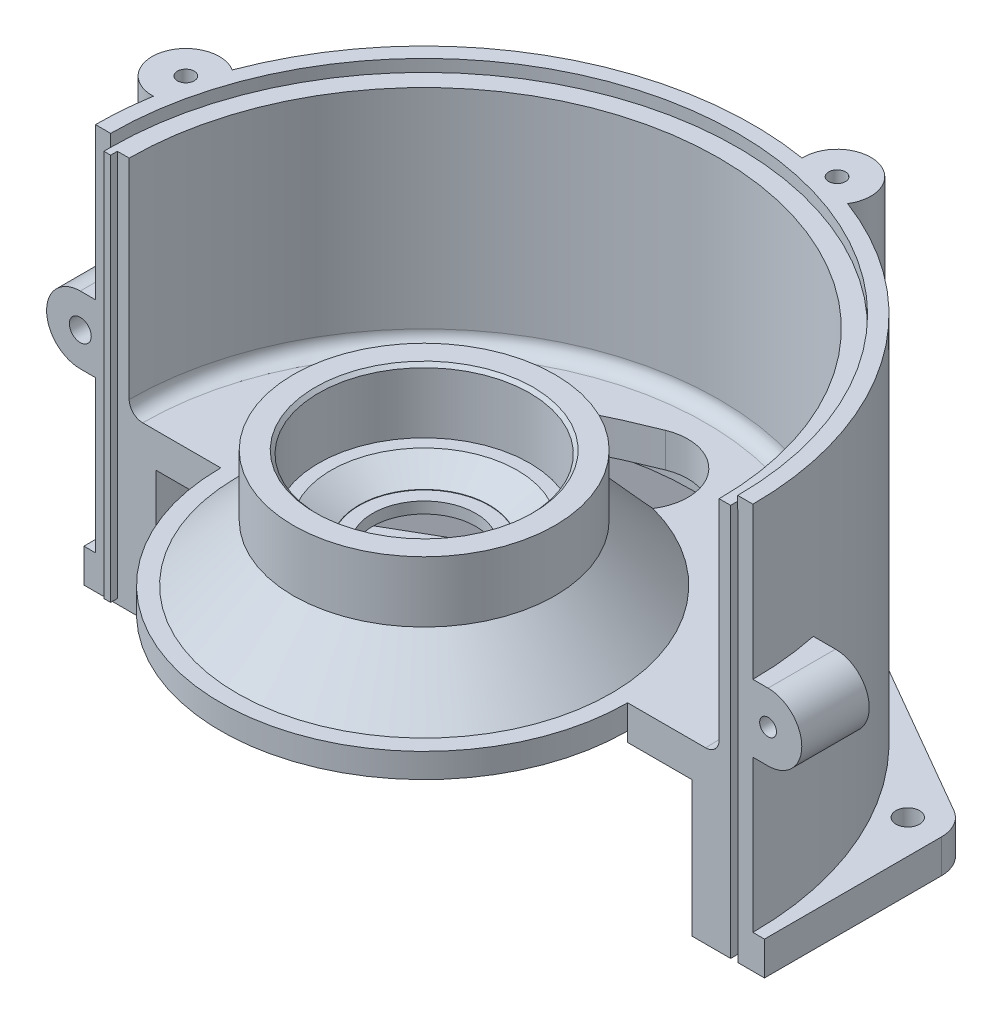
from build123d import *
from build123d.topology import SkipClean

# Parameters (mm, degrees)
REVOLU_O2_ANGLE           = 180
ESBO_O4_R                 = 10
RESSALTO_EXTRUS_O1_DEPTH  = 35
RESSALTO_EXTRUS_O10_DEPTH = 10
ESBO_O8_R                 = 3.5
CORTE_EXTRUS_O2_DEPTH     = 20
PADR_OCIRCULAR1_COUNT     = 6
ESBO_O6_R                 = 2.5
CORTE_EXTRUS_O1_DEPTH     = 15
ESBO_O9_R                 = 1.25
CORTE_EXTRUS_O3_DEPTH     = 6
ESBO_O10_W                = 2.2
ESBO_O10_H                = 116.4
CORTE_EXTRUS_O4_DEPTH     = 3.5
ESBO_O11_W                = 2
ESBO_O11_H                = 114.9
RESSALTO_EXTRUS_O5_DEPTH  = 2
ESBO_O12_R                = 3.25
RESSALTO_EXTRUS_O6_DEPTH  = 20
ESBO_O13_R                = 2.5
RESSALTO_EXTRUS_O7_DEPTH  = 20
CORTE_EXTRUS_O5_DEPTH     = 180.26806743
CORTE_EXTRUS_O6_START     = 10
ESBO_O16_R                = 93
CORTE_EXTRUS_O6_DEPTH     = 10
CORTE_EXTRUS_O8_DEPTH     = 15
ESBO_O22_R                = 1.65
CORTE_EXTRUS_O9_DEPTH     = 10


with BuildPart() as part:
    # Esboço3 → Revolução2 (revolve)
    with BuildSketch(Plane.XY):
        with BuildLine():
            Line((97.5, 79.8), (97.5, 11.304491341))
            Line((97.5, 11.304491341), (97.5, 0))
            Line((97.5, 0), (97.5, -40.2))
            Line((97.5, -40.2), (79.5, -40.2))
            Line((79.5, -40.2), (79.5, 0))
            Line((79.5, 0), (60.342408243, 0))
            Line((60.342408243, 0), (60.342408243, 2.95))
            Line((60.342408243, 2.95), (52, 2.95))
            Line((52, 2.95), (44, 10.95))
            Line((44, 10.95), (31, 10.95))
            Line((31, 10.95), (31, 13.7))
            Line((31, 13.7), (22.6, 13.7))
            Line((22.6, 13.7), (22.6, 17))
            Line((22.6, 17), (19.3, 17))
            Line((19.3, 17), (19.3, 17.7))
            Line((19.3, 17.7), (15.3, 17.7))
            Line((15.3, 17.7), (15.3, 21.05))
            Line((15.3, 21.05), (19.3, 21.05))
            Line((19.3, 21.05), (19.3, 21.2))
            Line((19.3, 21.2), (27.626549127, 25.96))
            Line((27.626549127, 25.96), (31.3, 25.96))
            Line((31.3, 25.96), (31.3, 43.96))
            Line((31.3, 43.96), (32.3, 44.96))
            Line((32.3, 44.96), (38.8, 44.96))
            Line((38.8, 44.96), (38.8, 26.9))
            Line((38.8, 26.9), (55.5, 10.2))
            Line((55.5, 10.2), (83.5, 10.2))
            ThreePointArc((83.5, 10.2), (86.328427125, 11.371572875), (87.5, 14.2))
            Line((87.5, 14.2), (87.5, 76.2))
            Line((87.5, 76.2), (93, 76.2))
            Line((93, 76.2), (93, 79.8))
            Line((93, 79.8), (97.5, 79.8))
        make_face()
    revolve(axis=Axis((0, -3.322055656, 0), (0, 1, 0)), revolution_arc=REVOLU_O2_ANGLE)

    # Esboço20 → Revolução3 (revolve)
    with SkipClean():  # the faces are left unmerged after this step: merging them gives an invalid solid
        with BuildSketch(Plane.XY):
            Polygon((60.342408243, 2.95), (60.342408243, 10.2), (55.5, 10.2), (38.8, 26.9), (38.8, 44.96), (32.3, 44.96), (31.3, 43.96), (31.3, 25.96), (27.626549127, 25.96), (19.3, 21.2), (19.3, 21.05), (15.3, 21.05), (15.3, 17.7), (19.3, 17.7), (19.3, 17), (22.6, 17), (22.6, 13.7), (31, 13.7), (31, 10.95), (44, 10.95), (52, 2.95), align=None)
        revolve(axis=Axis((0, -3.322055656, 0), (0, 1, 0)))

    # Esboço4 → Ressalto-extrusão1 (add)
    with SkipClean():  # the faces are left unmerged after this step: merging them gives an invalid solid
        with BuildSketch(Plane(origin=(0, 79.8, 0), x_dir=(1, 0, 0), z_dir=(0, 1, 0))):
            with Locations((25.881656302, 96.591656302)):
                Circle(ESBO_O4_R)
            with Locations((-96.591656302, 25.881656302)):
                Circle(ESBO_O4_R)
        extrude(amount=-RESSALTO_EXTRUS_O1_DEPTH)

    # Esboço23 → Ressalto-extrusão10 (add)
    with SkipClean():  # the faces are left unmerged after this step: merging them gives an invalid solid
        with BuildSketch(Plane.XZ.offset(40.2)):
            with BuildLine():
                Line((95.932667397, -61.160254038), (5, -113.660254038))
                ThreePointArc((5, -113.660254038), (0, -115), (-5, -113.660254038))
                Line((-5, -113.660254038), (-95.932667397, -61.160254038))
                ThreePointArc((-95.932667397, -61.160254038), (-99.592921435, -57.5), (-100.932667397, -52.5))
                Line((-100.932667397, -52.5), (-100.932667397, 0))
                Line((-100.932667397, 0), (-96.380584002, 0))
                ThreePointArc((-96.380584002, 0), (0, -96.380584002), (96.380584002, 0))
                Line((96.380584002, 0), (100.932667397, 0))
                Line((100.932667397, 0), (100.932667397, -52.5))
                ThreePointArc((100.932667397, -52.5), (99.592921435, -57.5), (95.932667397, -61.160254038))
            make_face()
        extrude(amount=-RESSALTO_EXTRUS_O10_DEPTH)

    # Esboço8 → Corte-extrusão2 (cut)
    with SkipClean():  # the faces are left unmerged after this step: merging them gives an invalid solid
        with BuildSketch(Plane.XZ.offset(30.2)):
            with Locations((0, -105)):
                Circle(ESBO_O8_R)
        corte_extrus_o2 = extrude(amount=CORTE_EXTRUS_O2_DEPTH, mode=Mode.SUBTRACT)

    # PadrãoCircular1: Corte-extrusão2 ×6 about axis
    with SkipClean():  # the faces are left unmerged after this step: merging them gives an invalid solid
        padr_ocircular1_axis = Axis((0, -3.322055656, 0), (0, -1, 0))
        for i in range(1, PADR_OCIRCULAR1_COUNT):
            add(corte_extrus_o2.rotate(padr_ocircular1_axis, i * 360 / PADR_OCIRCULAR1_COUNT), mode=Mode.SUBTRACT)

    # Esboço6 → Corte-extrusão1 (cut)
    with SkipClean():  # the faces are left unmerged after this step: merging them gives an invalid solid
        with BuildSketch(Plane(origin=(0, 79.8, 0), x_dir=(1, 0, 0), z_dir=(0, 1, 0))):
            with Locations((25.881656302, 96.591656302)):
                Circle(ESBO_O6_R)
            with Locations((-96.591656302, 25.881656302)):
                Circle(ESBO_O6_R)
        extrude(amount=-CORTE_EXTRUS_O1_DEPTH, mode=Mode.SUBTRACT)

    # Esboço9 → Corte-extrusão3 (cut)
    with SkipClean():  # the faces are left unmerged after this step: merging them gives an invalid solid
        with BuildSketch(Plane.XZ.offset(-13.7)):
            with Locations((18.738329701, -18.738329701)):
                Circle(ESBO_O9_R)
            with Locations((-18.738329701, -18.738329701)):
                Circle(ESBO_O9_R)
            with Locations((-18.738329701, 18.738329701)):
                Circle(ESBO_O9_R)
            with Locations((18.738329701, 18.738329701)):
                Circle(ESBO_O9_R)
        extrude(amount=-CORTE_EXTRUS_O3_DEPTH, mode=Mode.SUBTRACT)

    # Esboço10 → Corte-extrusão4 (cut)
    with SkipClean():  # the faces are left unmerged after this step: merging them gives an invalid solid
        with BuildSketch(Plane.XY):
            with Locations((92, 18)):
                Rectangle(ESBO_O10_W, ESBO_O10_H)
        extrude(amount=-CORTE_EXTRUS_O4_DEPTH, mode=Mode.SUBTRACT)

    # Esboço11 → Ressalto-extrusão5 (add)
    with SkipClean():  # the faces are left unmerged after this step: merging them gives an invalid solid
        with BuildSketch(Plane.XY):
            with Locations((-92, 18.75)):
                Rectangle(ESBO_O11_W, ESBO_O11_H)
        extrude(amount=RESSALTO_EXTRUS_O5_DEPTH)

    # Esboço12 → Ressalto-extrusão6 (add)
    with SkipClean():  # the faces are left unmerged after this step: merging them gives an invalid solid
        with BuildSketch(Plane.XY):
            with BuildLine():
                Line((-102, 34.8), (-87.5, 34.8))
                Line((-87.5, 34.8), (-87.5, 14.8))
                Line((-87.5, 14.8), (-102, 14.8))
                ThreePointArc((-102, 14.8), (-112, 24.8), (-102, 34.8))
            make_face()
            with Locations((-102, 24.8)):
                Circle(ESBO_O12_R, mode=Mode.SUBTRACT)
        extrude(amount=-RESSALTO_EXTRUS_O6_DEPTH)

    # Esboço13 → Ressalto-extrusão7 (add)
    with SkipClean():  # the faces are left unmerged after this step: merging them gives an invalid solid
        with BuildSketch(Plane.XY):
            with BuildLine():
                Line((102, 34.8), (93.1, 34.8))
                Line((93.1, 34.8), (93.1, 14.8))
                Line((93.1, 14.8), (102, 14.8))
                ThreePointArc((102, 14.8), (112, 24.8), (102, 34.8))
            make_face()
            with Locations((102, 24.8)):
                Circle(ESBO_O13_R, mode=Mode.SUBTRACT)
        extrude(amount=-RESSALTO_EXTRUS_O7_DEPTH)

    # Esboço14 → Corte-extrusão5 (cut, through all)
    with SkipClean():  # the faces are left unmerged after this step: merging them gives an invalid solid
        with BuildSketch(Plane(origin=(0, 0, 0), x_dir=(-1, 0, 0), z_dir=(0, -1, 0))):
            with BuildLine():
                ThreePointArc((63.496444288, 41.278050751), (35, 60.621778265), (3.999618425, 75.628559179))
                ThreePointArc((3.999618425, 75.628559179), (-15.47796402, 67.224763484), (-7.074168325, 47.747181039))
                ThreePointArc((-7.074168325, 47.747181039), (20, 34.641016151), (44.887355902, 17.747181039))
                ThreePointArc((44.887355902, 17.747181039), (65.957334951, 20.208071702), (63.496444288, 41.278050751))
            make_face()
        extrude(amount=-CORTE_EXTRUS_O5_DEPTH, mode=Mode.SUBTRACT)

    # Esboço16 → Corte-extrusão6 (cut)
    with SkipClean():  # the faces are left unmerged after this step: merging them gives an invalid solid
        with BuildSketch(Plane(origin=(0, 76.2, 0), x_dir=(1, 0, 0), z_dir=(0, 1, 0)).offset(CORTE_EXTRUS_O6_START)):
            Circle(ESBO_O16_R)
        extrude(amount=-CORTE_EXTRUS_O6_DEPTH, mode=Mode.SUBTRACT)

    # Esboço18 → Corte-extrusão8 (cut, symmetric)
    with SkipClean():  # the faces are left unmerged after this step: merging them gives an invalid solid
        with BuildSketch(Plane(origin=(0, -20.1, 0), x_dir=(-1, 0, 0), z_dir=(0, -1, 0))):
            Polygon((83.301270189, 44.282032303), (-3.301270189, 94.282032303), (-13.301270189, 76.961524227), (73.301270189, 26.961524227), align=None)
        extrude(amount=CORTE_EXTRUS_O8_DEPTH, both=True, mode=Mode.SUBTRACT)

    # Esboço22 → Corte-extrusão9 (cut)
    with SkipClean():  # the faces are left unmerged after this step: merging them gives an invalid solid
        with BuildSketch(Plane(origin=(-40, 0, -69.282032303), x_dir=(0.8660254037844368, 0, -0.5000000000000032), z_dir=(0.5000000000000032, 0, 0.8660254037844368))):
            with Locations((-15.9, -24.1)):
                Circle(ESBO_O22_R)
            with Locations((15.9, -24.1)):
                Circle(ESBO_O22_R)
        extrude(amount=-CORTE_EXTRUS_O9_DEPTH, mode=Mode.SUBTRACT)


solid = part.part
